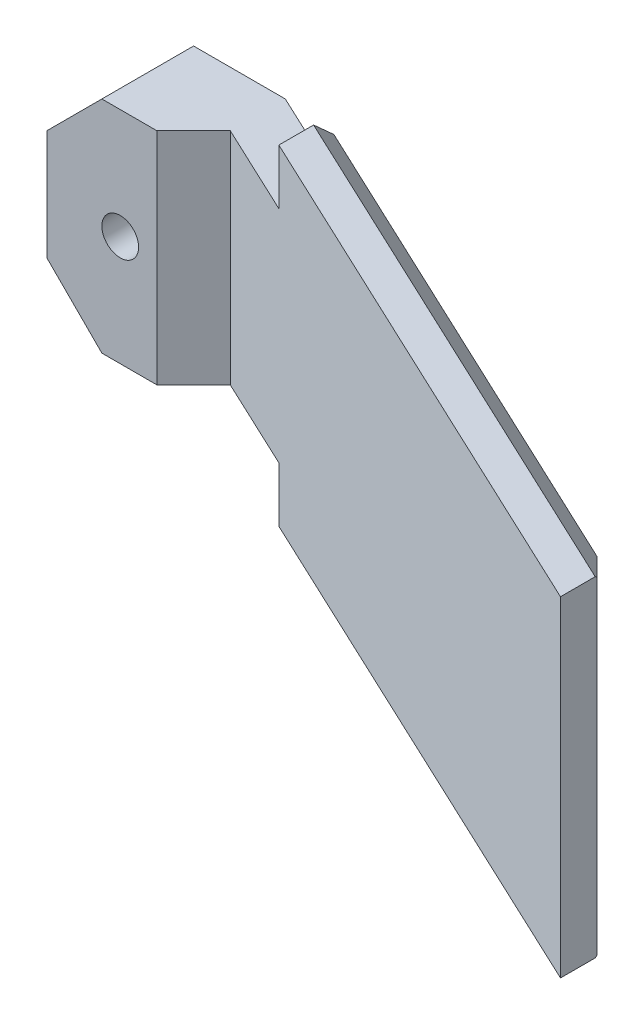
from build123d import *

# Parameters (mm, degrees)
SALIENTE_EXTRUIR1_DEPTH = 18
CROQUIS2_R              = 2.5
CORTAR_EXTRUIR1_DEPTH   = 2.5
CROQUIS3_W              = 13
CROQUIS3_H              = 3
CORTAR_EXTRUIR2_DEPTH   = 47.14108798
CHAFL_N1_SIZE           = 1
CHAFL_N2_SIZE           = 1
CHAFL_N2_SIZE2          = 2.087588248
CROQUIS4_W              = 8
CROQUIS4_H              = 12
SALIENTE_EXTRUIR2_DEPTH = 2
CROQUIS5_R              = 1
CORTAR_EXTRUIR3_DEPTH   = 46.169126624
CHAFL_N3_SIZE           = 3
CHAFL_N4_SIZE           = 2


with BuildPart() as part:
    # Croquis1 → Saliente-Extruir1 (new body)
    with BuildSketch(Plane(origin=(0, 0, 0), x_dir=(1, 0, 0), z_dir=(0, 1, 0))):
        Polygon((4, -1.5), (38, -17.5), (38, -14.5), (4, 1.5), (-4, 1.5), (-4, -1.5), align=None)
    extrude(amount=SALIENTE_EXTRUIR1_DEPTH)

    # Croquis2 → Cortar-Extruir1 (cut)
    with BuildSketch(Plane(origin=(0, 0, -1.5), x_dir=(-1, 0, 0), z_dir=(0, 0, -1))):
        with Locations((0, 9)):
            Circle(CROQUIS2_R)
    extrude(amount=-CORTAR_EXTRUIR1_DEPTH, mode=Mode.SUBTRACT)

    # Croquis3 → Cortar-Extruir2 (cut, through all)
    with BuildSketch(Plane(origin=(0, 0, -1.5), x_dir=(-1, 0, 0), z_dir=(0, 0, -1))):
        with Locations((-2.5, 16.5)):
            Rectangle(CROQUIS3_W, CROQUIS3_H)
        with Locations((-2.5, 1.5)):
            Rectangle(CROQUIS3_W, CROQUIS3_H)
    extrude(amount=-CORTAR_EXTRUIR2_DEPTH, mode=Mode.SUBTRACT)

    # Chaflán1
    chafl_n1_edges = [part.edges().sort_by_distance(p)[0] for p in [
        (23.5, 18, 7.676470588),
        (23.5, 0, 7.676470588),
    ]]
    chamfer(chafl_n1_edges, length=CHAFL_N1_SIZE)

    # Chaflán2
    chafl_n2_edges = [part.edges().sort_by_distance(p)[0] for p in [
        (38, 9, 14.5),
    ]]
    chafl_n2_side = [part.faces().sort_by_distance(p)[0] for p in [
        (38, 9, 16.023643901),
    ]]
    chamfer(chafl_n2_edges, length=CHAFL_N2_SIZE, length2=CHAFL_N2_SIZE2, reference=chafl_n2_side[0])

    # Croquis4 → Saliente-Extruir2 (add)
    with BuildSketch(Plane.XY.offset(1.5)):
        with Locations((0, 9)):
            Rectangle(CROQUIS4_W, CROQUIS4_H)
    extrude(amount=SALIENTE_EXTRUIR2_DEPTH)

    # Croquis5 → Cortar-Extruir3 (cut, through all)
    with BuildSketch(Plane(origin=(0, 0, 1), x_dir=(-1, 0, 0), z_dir=(0, 0, -1))):
        with Locations((0, 9)):
            Circle(CROQUIS5_R)
    extrude(amount=-CORTAR_EXTRUIR3_DEPTH, mode=Mode.SUBTRACT)

    # Chaflán3
    chafl_n3_edges = [part.edges().sort_by_distance(p)[0] for p in [
        (-4, 15, 1),
        (-4, 3, 1),
    ]]
    chamfer(chafl_n3_edges, length=CHAFL_N3_SIZE)

    # Chaflán4
    chafl_n4_edges = [part.edges().sort_by_distance(p)[0] for p in [
        (4, 9, 3.5),
    ]]
    chamfer(chafl_n4_edges, length=CHAFL_N4_SIZE - 0.0001)  # a hair under: the kernel refuses the full size


solid = part.part
